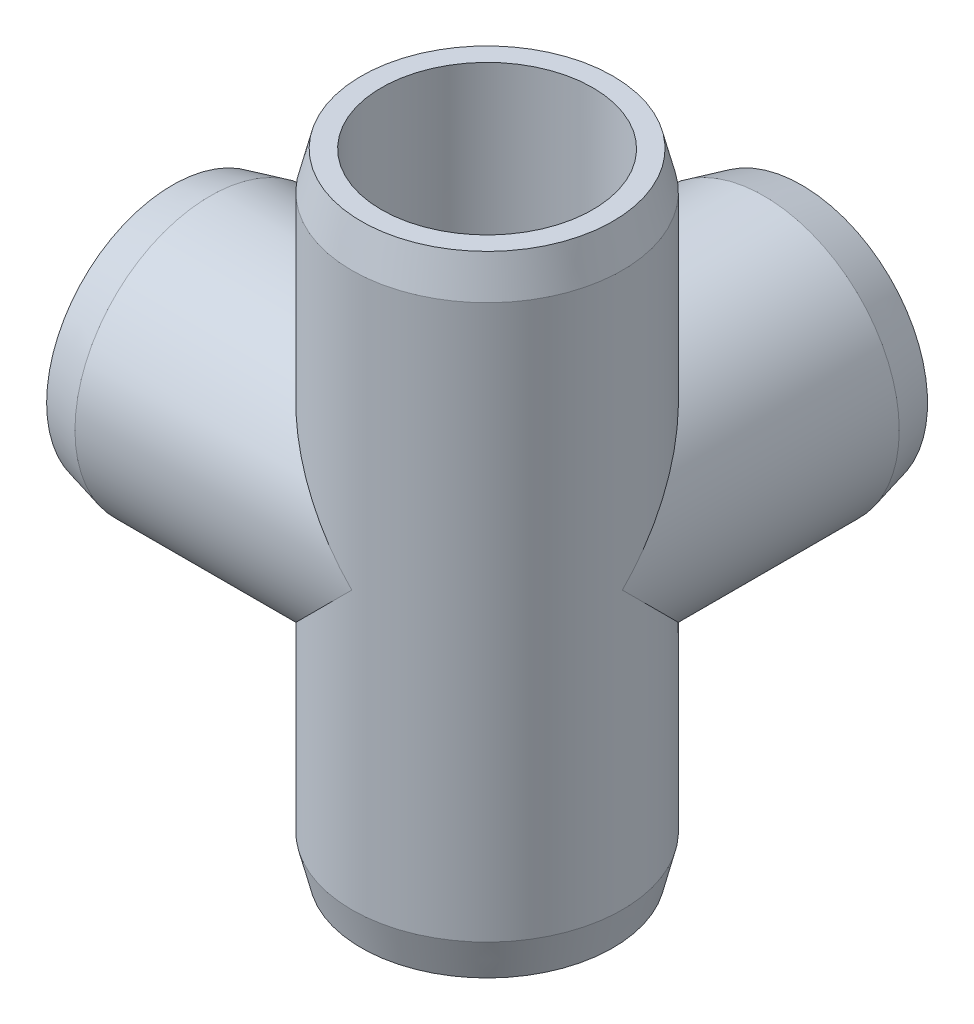
from build123d import *

# Parameters (mm, degrees)
SKETCH1_R                = 13.6525
SKETCH1_R_2              = 10.668
BOSS_EXTRUDE1_DEPTH      = 63.5
SKETCH3_R                = 10.668
CUT_EXTRUDE2_DEPTH       = 69.85
BOSS_EXTRUDE2_REACH      = 81.247
BOSS_EXTRUDE2_END_RADIUS = 13.6525
SKETCH4_R                = 13.6525
SKETCH4_R_2              = 10.668
SKETCH5_R                = 10.668
CUT_EXTRUDE3_DEPTH       = 69.85
BOSS_EXTRUDE3_REACH      = 86.272
BOSS_EXTRUDE3_END_RADIUS = 13.6525
SKETCH6_R                = 13.6525
SKETCH6_R_2              = 10.668
SKETCH8_R                = 10.668
CUT_EXTRUDE5_DEPTH       = 69.85
SKETCH10_W               = 1.27
SKETCH10_H               = 1.905
SKETCH11_W               = 1.27
SKETCH11_H               = 1.905
SKETCH12_W               = 1.905
SKETCH12_H               = 1.27
SKETCH13_W               = 1.905
SKETCH13_H               = 1.27


with BuildPart() as part:
    # Sketch1 → Boss-Extrude1 (new body)
    with BuildSketch(Plane(origin=(0, 0, 0), x_dir=(1, 0, 0), z_dir=(0, 1, 0))):
        Circle(SKETCH1_R)
        Circle(SKETCH1_R_2, mode=Mode.SUBTRACT)
    extrude(amount=BOSS_EXTRUDE1_DEPTH)

    # Sketch3 → Cut-Extrude2 (cut)
    with BuildSketch(Plane.XY):
        with Locations((0, 31.75)):
            Circle(SKETCH3_R)
    extrude(amount=-CUT_EXTRUDE2_DEPTH, mode=Mode.SUBTRACT)

    # Boss-Extrude2: up to this cylinder (the profile starts outside it)
    boss_extrude2_end = Plane(origin=(0, 31.75, 0), z_dir=(0, -1, 0)) * Cylinder(BOSS_EXTRUDE2_END_RADIUS, 190.799, mode=Mode.PRIVATE)
    # Sketch4 → Boss-Extrude2 (add, up to the surface)
    with BuildSketch(Plane.XY.offset(-31.75), mode=Mode.PRIVATE) as boss_extrude2_sk1:
        with Locations((0, 31.75)):
            Circle(SKETCH4_R)
        with Locations((0, 31.75)):
            Circle(SKETCH4_R_2, mode=Mode.SUBTRACT)
    boss_extrude2_tool1 = extrude(boss_extrude2_sk1.sketch, amount=BOSS_EXTRUDE2_REACH, mode=Mode.PRIVATE) - boss_extrude2_end
    add(boss_extrude2_tool1.solids().sort_by_distance((-13.266349, 31.75, -31.75))[0])

    # Sketch5 → Cut-Extrude3 (cut)
    with BuildSketch(Plane(origin=(0, 0, 0), x_dir=(0, 0, -1), z_dir=(1, 0, 0))):
        with Locations((0, 31.75)):
            Circle(SKETCH5_R)
    extrude(amount=-CUT_EXTRUDE3_DEPTH, mode=Mode.SUBTRACT)

    # Boss-Extrude3: up to this cylinder (the profile starts outside it)
    boss_extrude3_end = Plane(origin=(0, 31.75, 0), z_dir=(0, -1, 0)) * Cylinder(BOSS_EXTRUDE3_END_RADIUS, 200.849, mode=Mode.PRIVATE)
    # Sketch6 → Boss-Extrude3 (add, up to the surface)
    with BuildSketch(Plane(origin=(-31.75, 0, 0), x_dir=(0, 0, -1), z_dir=(1, 0, 0)), mode=Mode.PRIVATE) as boss_extrude3_sk1:
        with Locations((0, 31.75)):
            Circle(SKETCH6_R)
        with Locations((0, 31.75)):
            Circle(SKETCH6_R_2, mode=Mode.SUBTRACT)
    boss_extrude3_tool1 = extrude(boss_extrude3_sk1.sketch, amount=BOSS_EXTRUDE3_REACH, mode=Mode.PRIVATE) - boss_extrude3_end
    add(boss_extrude3_tool1.solids().sort_by_distance((-31.75, 31.75, 13.266349))[0])

    # Sketch8 → Cut-Extrude5 (cut)
    with BuildSketch(Plane.XY):
        with Locations((0, 31.75)):
            Circle(SKETCH8_R)
    extrude(amount=-CUT_EXTRUDE5_DEPTH, mode=Mode.SUBTRACT)

    # Sketch13 → Revolve7 (revolve)
    with BuildSketch(Plane(origin=(0, 0, 0), x_dir=(0, 0, -1), z_dir=(1, 0, 0))):
        with Locations((11.7475, 41.783)):
            Rectangle(SKETCH13_W, SKETCH13_H)
    revolve(axis=Axis((0, 31.75, -31.75), (0, 0, 1)))

    # Sketch14 → Cut-Revolve1 (revolve, cut)
    with BuildSketch(Plane(origin=(0, 0, 0), x_dir=(0, 0, -1), z_dir=(1, 0, 0))):
        Polygon((13.6525, 0), (13.6525, 3.81), (12.7, 0), align=None)
    cut_revolve1 = revolve(axis=Axis((0, 0, 0), (0, 1, 0)), mode=Mode.SUBTRACT)

    # Mirror1: Cut-Revolve1 across plane
    add(cut_revolve1.mirror(Plane.ZX.offset(31.75)), mode=Mode.SUBTRACT)

    # Sketch15 → Cut-Revolve2 (revolve, cut)
    with BuildSketch(Plane(origin=(0, 31.75, 0), x_dir=(1, 0, 0), z_dir=(0, 1, 0))):
        Polygon((-13.6525, 31.75), (-13.6525, 27.94), (-12.7, 31.75), align=None)
    revolve(axis=Axis((0, 31.75, -31.75), (0, 0, 1)), mode=Mode.SUBTRACT)

    # Sketch16 → Cut-Revolve3 (revolve, cut)
    with BuildSketch(Plane(origin=(0, 31.75, 0), x_dir=(1, 0, 0), z_dir=(0, 1, 0))):
        Polygon((-31.75, -13.6525), (-27.94, -13.6525), (-31.75, -12.7), align=None)
    revolve(axis=Axis((-31.75, 31.75, 0), (1, 0, 0)), mode=Mode.SUBTRACT)


with BuildPart() as body_2:
    # Sketch10 → Revolve1 (revolve)
    with BuildSketch(Plane.XY):
        with Locations((-9.8425, 43.4975)):
            Rectangle(SKETCH10_W, SKETCH10_H)
    revolve(axis=Axis((0, 63.5, 0), (0, -1, 0)))


with BuildPart() as body_3:
    # Sketch11 → Revolve5 (revolve)
    with BuildSketch(Plane.XY):
        with Locations((-9.8425, 20.0025)):
            Rectangle(SKETCH11_W, SKETCH11_H)
    revolve(axis=Axis((0, 0, 0), (0, 1, 0)))


with BuildPart() as body_4:
    # Sketch12 → Revolve6 (revolve)
    with BuildSketch(Plane.XY):
        with Locations((-11.7475, 41.5925)):
            Rectangle(SKETCH12_W, SKETCH12_H)
    revolve(axis=Axis((-31.75, 31.75, 0), (1, 0, 0)))


solid = Compound([part.part, body_2.part, body_3.part, body_4.part])
